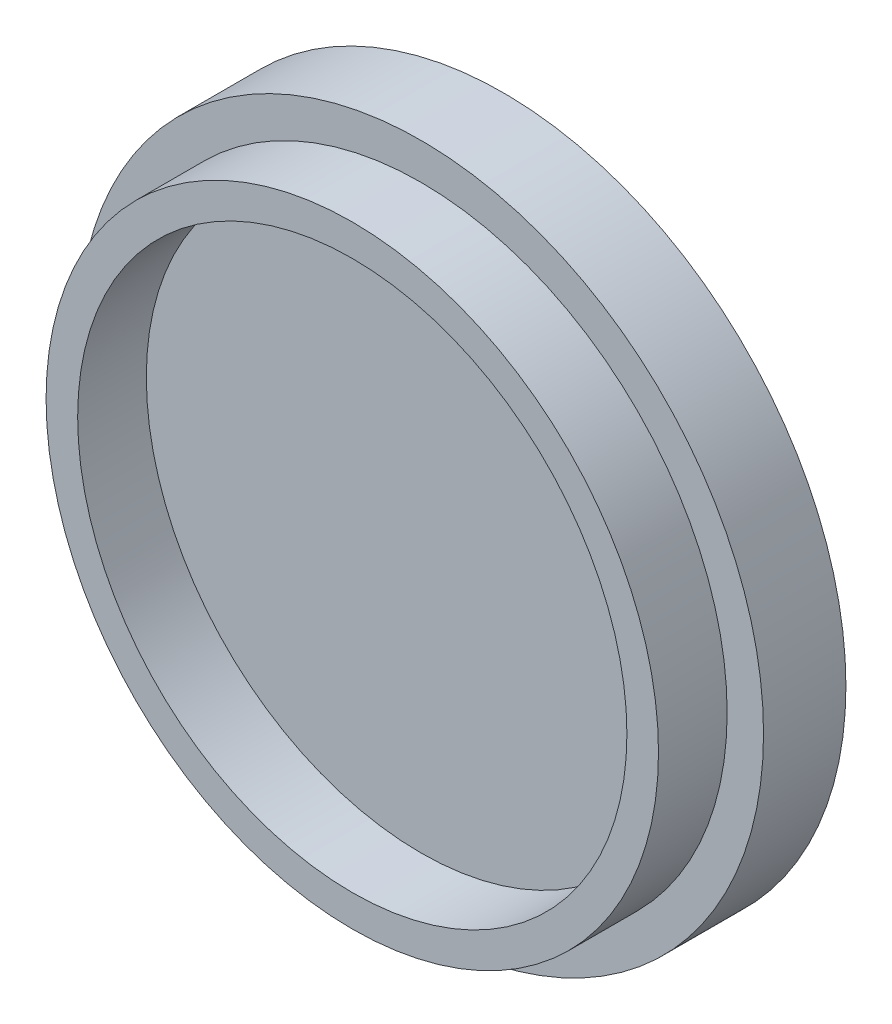
from build123d import *

# Parameters (mm, degrees)
SKETCH1_R           = 24.95
BOSS_EXTRUDE1_DEPTH = 6
SKETCH2_R           = 22.3
SKETCH2_R_2         = 20
BOSS_EXTRUDE2_DEPTH = 5


with BuildPart() as part:
    # Sketch1 → Boss-Extrude1 (new body)
    with BuildSketch(Plane.XY):
        Circle(SKETCH1_R)
    extrude(amount=BOSS_EXTRUDE1_DEPTH)

    # Sketch2 → Boss-Extrude2 (add)
    with BuildSketch(Plane.XY.offset(6)):
        Circle(SKETCH2_R)
        Circle(SKETCH2_R_2, mode=Mode.SUBTRACT)
    extrude(amount=BOSS_EXTRUDE2_DEPTH)


solid = part.part
